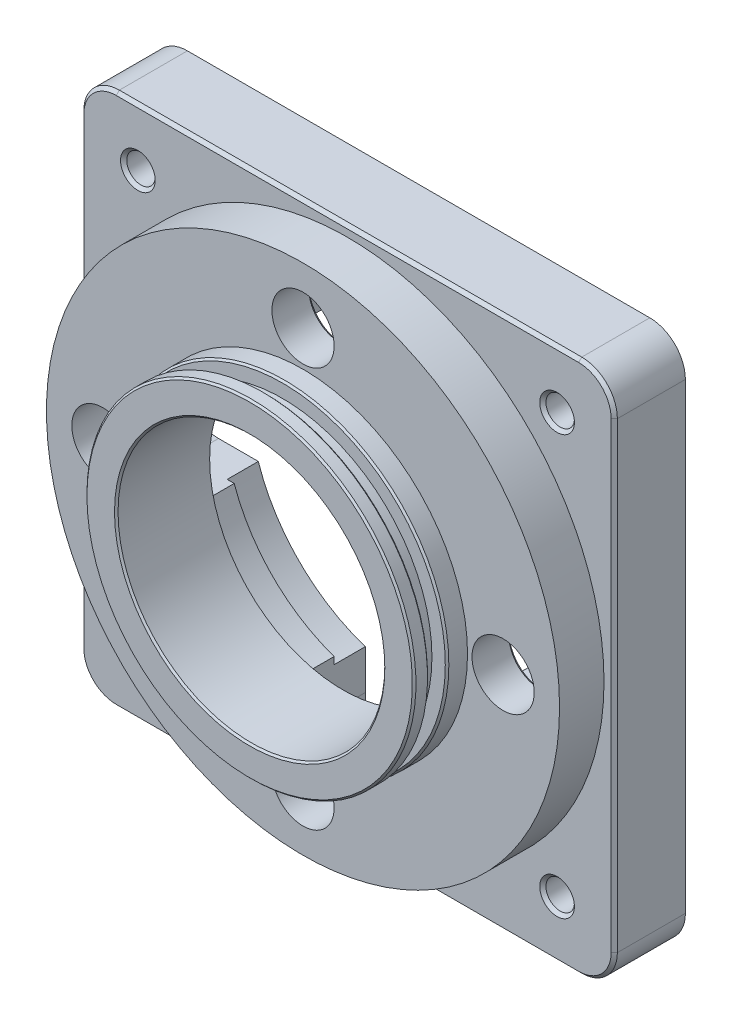
from build123d import *

# Parameters (mm, degrees)
SKICA1_W                    = 60
SKICA1_H                    = 60
P_IDAT_VYSUNUT_M1_DEPTH     = 10
SKICA2_R                    = 28.85
P_IDAT_VYSUNUT_M2_DEPTH     = 5
SKICA3_R                    = 18.5
P_IDAT_VYSUNUT_M3_DEPTH     = 6
SKICA4_R                    = 15
ODEBRAT_VYSUNUT_M1_DEPTH    = 48.339201514
SKICA5_W                    = 1.7
SKICA5_H                    = 2
ZKOSEN_1_SIZE               = 0.2
SKICA6_R                    = 1.6
ODEBRAT_VYSUNUT_M2_DEPTH    = 48.339201514
SKICA7_R                    = 3.5
ODEBRAT_VYSUNUT_M3_DEPTH    = 46
ODEBRAT_VYSUNUT_M6_DEPTH    = 10.5
SKICA9_R                    = 19
ODEBRAT_VYSUNUT_M7_DEPTH    = 5.5
ODEBRAT_VYSUNUT_M8_DEPTH    = 6
ZAOBLIT1_R                  = 4
ZKOSEN_2_SIZE               = 0.35
P_ESUNOUT_PLOCHU1_OUTLINE_R = 1.6
P_ESUNOUT_PLOCHU1_DEPTH     = 2


# Read off the part's stored shape, not the designer's step: Přesunout plochu1
with BuildPart() as part:
    # Skica1 → Přidat vysunutím1 (new body)
    with BuildSketch(Plane.XY):
        Rectangle(SKICA1_W, SKICA1_H)
    extrude(amount=P_IDAT_VYSUNUT_M1_DEPTH)

    # Skica2 → Přidat vysunutím2 (add)
    with BuildSketch(Plane.XY.offset(10)):
        Circle(SKICA2_R)
    extrude(amount=P_IDAT_VYSUNUT_M2_DEPTH)

    # Skica3 → Přidat vysunutím3 (add)
    with BuildSketch(Plane.XY.offset(15)):
        Circle(SKICA3_R)
    extrude(amount=P_IDAT_VYSUNUT_M3_DEPTH)

    # Skica4 → Odebrat vysunutím1 (cut, through all)
    with BuildSketch(Plane.XY.offset(21)):
        Circle(SKICA4_R)
    extrude(amount=-ODEBRAT_VYSUNUT_M1_DEPTH, mode=Mode.SUBTRACT)

    # Skica5 → Odebrat rotací1 (revolve, cut)
    with BuildSketch(Plane(origin=(0, 0, 0), x_dir=(1, 0, 0), z_dir=(0, 1, 0)), mode=Mode.PRIVATE) as odebrat_rotac_1_sk:
        with Locations((17.65, -18.3)):
            Rectangle(SKICA5_W, SKICA5_H)
    revolve(odebrat_rotac_1_sk.sketch.rotate(Axis((0, 0, 0), (0, 0, 1)), 180), axis=Axis((0, 0, 0), (0, 0, 1)), mode=Mode.SUBTRACT)

    # Zkosení1
    zkosen_1_edges = [part.edges().sort_by_distance(p)[0] for p in [
        (-18.5, 0, 21),
        (-15, 0, 21),
        (-18.5, 0, 19.3),
        (-18.5, 0, 17.3),
    ]]
    chamfer(zkosen_1_edges, length=ZKOSEN_1_SIZE)

    # Skica6 → Odebrat vysunutím2 (cut, through all)
    with BuildSketch(Plane(origin=(0, 0, 0), x_dir=(-1, 0, 0), z_dir=(0, 0, -1))):
        with Locations((-23.57, 23.57)):
            Circle(SKICA6_R)
        with Locations((23.57, 23.57)):
            Circle(SKICA6_R)
        with Locations(Location((23.57, -23.57, 0), (0, 0, 180))):
            Circle(SKICA6_R)
        with Locations(Location((-23.57, -23.57, 0), (0, 0, 180))):
            Circle(SKICA6_R)
    extrude(amount=-ODEBRAT_VYSUNUT_M2_DEPTH, mode=Mode.SUBTRACT)

    # Skica7 → Odebrat vysunutím3 (cut, through all)
    with BuildSketch(Plane.XY.offset(15)):
        with Locations((0, 22.5)):
            Circle(SKICA7_R)
        with Locations((0, -22.5)):
            Circle(SKICA7_R)
        with Locations((22.5, 0)):
            Circle(SKICA7_R)
        with Locations((-22.5, 0)):
            Circle(SKICA7_R)
    extrude(amount=-ODEBRAT_VYSUNUT_M3_DEPTH, mode=Mode.SUBTRACT)

    # Skica8 → Odebrat vysunutím6 (cut)
    with BuildSketch(Plane(origin=(0, 0, 0), x_dir=(-1, 0, 0), z_dir=(0, 0, -1))):
        with BuildLine():
            Line((-6, 22.5), (-6, 17.235501153))
            ThreePointArc((-6, 17.235501153), (-12.904698757, 12.904698757), (-17.235501153, 6))
            Line((-17.235501153, 6), (-22.5, 6))
            ThreePointArc((-22.5, 6), (-28.5, 0), (-22.5, -6))
            Line((-22.5, -6), (-17.235501153, -6))
            ThreePointArc((-17.235501153, -6), (-12.904698757, -12.904698757), (-6, -17.235501153))
            Line((-6, -17.235501153), (-6, -22.5))
            ThreePointArc((-6, -22.5), (0, -28.5), (6, -22.5))
            Line((6, -22.5), (6, -17.235501153))
            ThreePointArc((6, -17.235501153), (12.904698757, -12.904698757), (17.235501153, -6))
            Line((17.235501153, -6), (22.5, -6))
            ThreePointArc((22.5, -6), (28.5, 0), (22.5, 6))
            Line((22.5, 6), (17.235501153, 6))
            ThreePointArc((17.235501153, 6), (12.904698757, 12.904698757), (6, 17.235501153))
            Line((6, 17.235501153), (6, 22.5))
            ThreePointArc((6, 22.5), (0, 28.5), (-6, 22.5))
        make_face()
    extrude(amount=-ODEBRAT_VYSUNUT_M6_DEPTH, mode=Mode.SUBTRACT)

    # Skica9 → Odebrat vysunutím7 (cut)
    with BuildSketch(Plane(origin=(0, 0, 0), x_dir=(-1, 0, 0), z_dir=(0, 0, -1))):
        Circle(SKICA9_R)
    extrude(amount=-ODEBRAT_VYSUNUT_M7_DEPTH, mode=Mode.SUBTRACT)

    # Skica10 → Odebrat vysunutím8 (cut)
    with BuildSketch(Plane(origin=(0, 0, 0), x_dir=(-1, 0, 0), z_dir=(0, 0, -1))):
        with BuildLine():
            Line((26.9, 17.541642015), (26.9, 10.195587281))
            ThreePointArc((26.9, 10.195587281), (26.304000543, 8.998598133), (24.989622642, 8.752815496))
            ThreePointArc((24.989622642, 8.752815496), (23.75685699, 9.012785946), (22.5, 9.1))
            Line((22.5, 9.1), (20.774984958, 9.1))
            ThreePointArc((20.774984958, 9.1), (20.244527343, 9.25228854), (19.87563496, 9.662770563))
            ThreePointArc((19.87563496, 9.662770563), (15.627059864, 15.627059864), (9.662770563, 19.87563496))
            ThreePointArc((9.662770563, 19.87563496), (9.25228854, 20.244527343), (9.1, 20.774984958))
            Line((9.1, 20.774984958), (9.1, 22.5))
            ThreePointArc((9.1, 22.5), (9.012785946, 23.75685699), (8.752815496, 24.989622642))
            ThreePointArc((8.752815496, 24.989622642), (8.998598133, 26.304000543), (10.195587281, 26.9))
            Line((10.195587281, 26.9), (17.541642015, 26.9))
            ThreePointArc((17.541642015, 26.9), (18.746542722, 26.293428389), (18.976965344, 24.964285714))
            ThreePointArc((18.976965344, 24.964285714), (20.17588745, 20.17588745), (24.964285714, 18.976965344))
            ThreePointArc((24.964285714, 18.976965344), (26.293428389, 18.746542722), (26.9, 17.541642015))
        make_face()
        with BuildLine():
            Line((-20.774984958, 9.1), (-22.5, 9.1))
            ThreePointArc((-22.5, 9.1), (-23.75685699, 9.012785946), (-24.989622642, 8.752815496))
            ThreePointArc((-24.989622642, 8.752815496), (-26.304000543, 8.998598133), (-26.9, 10.195587281))
            Line((-26.9, 10.195587281), (-26.9, 17.541642015))
            ThreePointArc((-26.9, 17.541642015), (-26.293428389, 18.746542722), (-24.964285714, 18.976965344))
            ThreePointArc((-24.964285714, 18.976965344), (-20.17588745, 20.17588745), (-18.976965344, 24.964285714))
            ThreePointArc((-18.976965344, 24.964285714), (-18.746542722, 26.293428389), (-17.541642015, 26.9))
            Line((-17.541642015, 26.9), (-10.195587281, 26.9))
            ThreePointArc((-10.195587281, 26.9), (-8.998598133, 26.304000543), (-8.752815496, 24.989622642))
            ThreePointArc((-8.752815496, 24.989622642), (-9.012785946, 23.75685699), (-9.1, 22.5))
            Line((-9.1, 22.5), (-9.1, 20.774984958))
            ThreePointArc((-9.1, 20.774984958), (-9.25228854, 20.244527343), (-9.662770563, 19.87563496))
            ThreePointArc((-9.662770563, 19.87563496), (-15.627059864, 15.627059864), (-19.87563496, 9.662770563))
            ThreePointArc((-19.87563496, 9.662770563), (-20.244527343, 9.25228854), (-20.774984958, 9.1))
        make_face()
        with BuildLine():
            Line((-22.5, -9.1), (-20.774984958, -9.1))
            ThreePointArc((-20.774984958, -9.1), (-20.244527343, -9.25228854), (-19.87563496, -9.662770563))
            ThreePointArc((-19.87563496, -9.662770563), (-15.627059864, -15.627059864), (-9.662770563, -19.87563496))
            ThreePointArc((-9.662770563, -19.87563496), (-9.25228854, -20.244527343), (-9.1, -20.774984958))
            Line((-9.1, -20.774984958), (-9.1, -22.5))
            ThreePointArc((-9.1, -22.5), (-9.012785946, -23.75685699), (-8.752815496, -24.989622642))
            ThreePointArc((-8.752815496, -24.989622642), (-8.998598133, -26.304000543), (-10.195587281, -26.9))
            Line((-10.195587281, -26.9), (-17.541642015, -26.9))
            ThreePointArc((-17.541642015, -26.9), (-18.746542722, -26.293428389), (-18.976965344, -24.964285714))
            ThreePointArc((-18.976965344, -24.964285714), (-20.17588745, -20.17588745), (-24.964285714, -18.976965344))
            ThreePointArc((-24.964285714, -18.976965344), (-26.293428389, -18.746542722), (-26.9, -17.541642015))
            Line((-26.9, -17.541642015), (-26.9, -10.195587281))
            ThreePointArc((-26.9, -10.195587281), (-26.304000543, -8.998598133), (-24.989622642, -8.752815496))
            ThreePointArc((-24.989622642, -8.752815496), (-23.75685699, -9.012785946), (-22.5, -9.1))
        make_face()
        with BuildLine():
            Line((9.1, -22.5), (9.1, -20.774984958))
            ThreePointArc((9.1, -20.774984958), (9.25228854, -20.244527343), (9.662770563, -19.87563496))
            ThreePointArc((9.662770563, -19.87563496), (15.627059864, -15.627059864), (19.87563496, -9.662770563))
            ThreePointArc((19.87563496, -9.662770563), (20.244527343, -9.25228854), (20.774984958, -9.1))
            Line((20.774984958, -9.1), (22.5, -9.1))
            ThreePointArc((22.5, -9.1), (23.75685699, -9.012785946), (24.989622642, -8.752815496))
            ThreePointArc((24.989622642, -8.752815496), (26.304000543, -8.998598133), (26.9, -10.195587281))
            Line((26.9, -10.195587281), (26.9, -17.541642015))
            ThreePointArc((26.9, -17.541642015), (26.293428389, -18.746542722), (24.964285714, -18.976965344))
            ThreePointArc((24.964285714, -18.976965344), (20.17588745, -20.17588745), (18.976965344, -24.964285714))
            ThreePointArc((18.976965344, -24.964285714), (18.746542722, -26.293428389), (17.541642015, -26.9))
            Line((17.541642015, -26.9), (10.195587281, -26.9))
            ThreePointArc((10.195587281, -26.9), (8.998598133, -26.304000543), (8.752815496, -24.989622642))
            ThreePointArc((8.752815496, -24.989622642), (9.012785946, -23.75685699), (9.1, -22.5))
        make_face()
    extrude(amount=-ODEBRAT_VYSUNUT_M8_DEPTH, mode=Mode.SUBTRACT)

    # Zaoblit1
    zaoblit1_edges = [part.edges().sort_by_distance(p)[0] for p in [
        (30, -30, 5),
        (-30, -30, 5),
        (-30, 30, 5),
        (30, 30, 5),
    ]]
    fillet(zaoblit1_edges, radius=ZAOBLIT1_R)

    # Zkosení2
    zkosen_2_edges = [part.edges().sort_by_distance(p)[0] for p in [
        (-13.435028843, 13.435028843, 0),
        (-13.435028843, -13.435028843, 0),
        (13.435028843, -13.435028843, 0),
        (13.435028843, 13.435028843, 0),
        (30, 0, 10),
        (0, -30, 10),
        (0, 30, 10),
        (-30, 0, 10),
        (28.828427125, 28.828427125, 10),
        (-28.828427125, 28.828427125, 10),
        (-28.828427125, -28.828427125, 10),
        (28.828427125, -28.828427125, 10),
        (21.97, -23.57, 10),
        (21.97, -23.57, 0),
        (-25.17, -23.57, 10),
        (-25.17, -23.57, 0),
        (-21.97, 23.57, 10),
        (-21.97, 23.57, 0),
        (25.17, 23.57, 10),
        (25.17, 23.57, 0),
        (-26, 0, 10.5),
        (-3.5, -22.5, 10.5),
        (-3.5, 22.5, 10.5),
        (19, 0, 10.5),
    ]]
    chamfer(zkosen_2_edges, length=ZKOSEN_2_SIZE)

    # Přesunout plochu1 outline → Přesunout plochu1 (cut)
    with BuildSketch(Plane.XY):
        with BuildLine():
            Line((30, -26), (30, 26))
            ThreePointArc((30, 26), (28.828427125, 28.828427125), (26, 30))
            Line((26, 30), (-26, 30))
            ThreePointArc((-26, 30), (-28.828427125, 28.828427125), (-30, 26))
            Line((-30, 26), (-30, -26))
            ThreePointArc((-30, -26), (-28.828427125, -28.828427125), (-26, -30))
            Line((-26, -30), (26, -30))
            ThreePointArc((26, -30), (28.828427125, -28.828427125), (30, -26))
        make_face()
        with Locations((-23.57, -23.57)):
            Circle(P_ESUNOUT_PLOCHU1_OUTLINE_R, mode=Mode.SUBTRACT)
        with BuildLine():
            Line((-22.5, -9.1), (-20.774984958, -9.1))
            ThreePointArc((-20.774984958, -9.1), (-20.244527343, -9.25228854), (-19.87563496, -9.662770563))
            ThreePointArc((-19.87563496, -9.662770563), (-15.627059864, -15.627059864), (-9.662770563, -19.87563496))
            ThreePointArc((-9.662770563, -19.87563496), (-9.25228854, -20.244527343), (-9.1, -20.774984958))
            Line((-9.1, -20.774984958), (-9.1, -22.5))
            ThreePointArc((-9.1, -22.5), (-9.012785946, -23.756856991), (-8.752815496, -24.989622642))
            ThreePointArc((-8.752815496, -24.989622642), (-8.998598133, -26.304000543), (-10.195587281, -26.9))
            Line((-10.195587281, -26.9), (-17.541642015, -26.9))
            ThreePointArc((-17.541642015, -26.9), (-18.746542722, -26.293428389), (-18.976965344, -24.964285714))
            ThreePointArc((-18.976965344, -24.964285714), (-20.17588745, -20.17588745), (-24.964285714, -18.976965344))
            ThreePointArc((-24.964285714, -18.976965344), (-26.293428389, -18.746542722), (-26.9, -17.541642015))
            Line((-26.9, -17.541642015), (-26.9, -10.195587281))
            ThreePointArc((-26.9, -10.195587281), (-26.304000543, -8.998598133), (-24.989622642, -8.752815496))
            ThreePointArc((-24.989622642, -8.752815496), (-23.756856991, -9.012785946), (-22.5, -9.1))
        make_face(mode=Mode.SUBTRACT)
        with Locations((23.57, -23.57)):
            Circle(P_ESUNOUT_PLOCHU1_OUTLINE_R, mode=Mode.SUBTRACT)
        with BuildLine():
            Line((26.9, -10.195587281), (26.9, -17.541642015))
            ThreePointArc((26.9, -17.541642015), (26.293428389, -18.746542722), (24.964285714, -18.976965344))
            ThreePointArc((24.964285714, -18.976965344), (20.17588745, -20.17588745), (18.976965344, -24.964285714))
            ThreePointArc((18.976965344, -24.964285714), (18.746542722, -26.293428389), (17.541642015, -26.9))
            Line((17.541642015, -26.9), (10.195587281, -26.9))
            ThreePointArc((10.195587281, -26.9), (8.998598133, -26.304000543), (8.752815496, -24.989622642))
            ThreePointArc((8.752815496, -24.989622642), (9.012785946, -23.756856991), (9.1, -22.5))
            Line((9.1, -22.5), (9.1, -20.774984958))
            ThreePointArc((9.1, -20.774984958), (9.25228854, -20.244527343), (9.662770563, -19.87563496))
            ThreePointArc((9.662770563, -19.87563496), (15.627059864, -15.627059864), (19.87563496, -9.662770563))
            ThreePointArc((19.87563496, -9.662770563), (20.244527343, -9.25228854), (20.774984958, -9.1))
            Line((20.774984958, -9.1), (22.5, -9.1))
            ThreePointArc((22.5, -9.1), (23.756856991, -9.012785946), (24.989622642, -8.752815496))
            ThreePointArc((24.989622642, -8.752815496), (26.304000543, -8.998598133), (26.9, -10.195587281))
        make_face(mode=Mode.SUBTRACT)
        with BuildLine():
            ThreePointArc((-9.662770563, 19.87563496), (-15.627059864, 15.627059864), (-19.87563496, 9.662770563))
            ThreePointArc((-19.87563496, 9.662770563), (-20.244527343, 9.25228854), (-20.774984958, 9.1))
            Line((-20.774984958, 9.1), (-22.5, 9.1))
            ThreePointArc((-22.5, 9.1), (-23.756856991, 9.012785946), (-24.989622642, 8.752815496))
            ThreePointArc((-24.989622642, 8.752815496), (-26.304000543, 8.998598133), (-26.9, 10.195587281))
            Line((-26.9, 10.195587281), (-26.9, 17.541642015))
            ThreePointArc((-26.9, 17.541642015), (-26.293428389, 18.746542722), (-24.964285714, 18.976965344))
            ThreePointArc((-24.964285714, 18.976965344), (-20.17588745, 20.17588745), (-18.976965344, 24.964285714))
            ThreePointArc((-18.976965344, 24.964285714), (-18.746542722, 26.293428389), (-17.541642015, 26.9))
            Line((-17.541642015, 26.9), (-10.195587281, 26.9))
            ThreePointArc((-10.195587281, 26.9), (-8.998598133, 26.304000543), (-8.752815496, 24.989622642))
            ThreePointArc((-8.752815496, 24.989622642), (-9.012785946, 23.756856991), (-9.1, 22.5))
            Line((-9.1, 22.5), (-9.1, 20.774984958))
            ThreePointArc((-9.1, 20.774984958), (-9.25228854, 20.244527343), (-9.662770563, 19.87563496))
        make_face(mode=Mode.SUBTRACT)
        with Locations((-23.57, 23.57)):
            Circle(P_ESUNOUT_PLOCHU1_OUTLINE_R, mode=Mode.SUBTRACT)
        with BuildLine():
            Line((-6, 18.027756377), (-6, 22.5))
            ThreePointArc((-6, 22.5), (0, 28.5), (6, 22.5))
            Line((6, 22.5), (6, 18.027756377))
            ThreePointArc((6, 18.027756377), (13.435028843, 13.435028843), (18.027756377, 6))
            Line((18.027756377, 6), (22.5, 6))
            ThreePointArc((22.5, 6), (28.5, 0), (22.5, -6))
            Line((22.5, -6), (18.027756377, -6))
            ThreePointArc((18.027756377, -6), (13.435028843, -13.435028843), (6, -18.027756377))
            Line((6, -18.027756377), (6, -22.5))
            ThreePointArc((6, -22.5), (0, -28.5), (-6, -22.5))
            Line((-6, -22.5), (-6, -18.027756377))
            ThreePointArc((-6, -18.027756377), (-13.435028843, -13.435028843), (-18.027756377, -6))
            Line((-18.027756377, -6), (-22.5, -6))
            ThreePointArc((-22.5, -6), (-28.5, 0), (-22.5, 6))
            Line((-22.5, 6), (-18.027756377, 6))
            ThreePointArc((-18.027756377, 6), (-13.435028843, 13.435028843), (-6, 18.027756377))
        make_face(mode=Mode.SUBTRACT)
        with BuildLine():
            Line((26.9, 17.541642015), (26.9, 10.195587281))
            ThreePointArc((26.9, 10.195587281), (26.304000543, 8.998598133), (24.989622642, 8.752815496))
            ThreePointArc((24.989622642, 8.752815496), (23.756856991, 9.012785946), (22.5, 9.1))
            Line((22.5, 9.1), (20.774984958, 9.1))
            ThreePointArc((20.774984958, 9.1), (20.244527343, 9.25228854), (19.87563496, 9.662770563))
            ThreePointArc((19.87563496, 9.662770563), (15.627059864, 15.627059864), (9.662770563, 19.87563496))
            ThreePointArc((9.662770563, 19.87563496), (9.25228854, 20.244527343), (9.1, 20.774984958))
            Line((9.1, 20.774984958), (9.1, 22.5))
            ThreePointArc((9.1, 22.5), (9.012785946, 23.756856991), (8.752815496, 24.989622642))
            ThreePointArc((8.752815496, 24.989622642), (8.998598133, 26.304000543), (10.195587281, 26.9))
            Line((10.195587281, 26.9), (17.541642015, 26.9))
            ThreePointArc((17.541642015, 26.9), (18.746542722, 26.293428389), (18.976965344, 24.964285714))
            ThreePointArc((18.976965344, 24.964285714), (20.17588745, 20.17588745), (24.964285714, 18.976965344))
            ThreePointArc((24.964285714, 18.976965344), (26.293428389, 18.746542722), (26.9, 17.541642015))
        make_face(mode=Mode.SUBTRACT)
        with Locations((23.57, 23.57)):
            Circle(P_ESUNOUT_PLOCHU1_OUTLINE_R, mode=Mode.SUBTRACT)
    extrude(amount=P_ESUNOUT_PLOCHU1_DEPTH, mode=Mode.SUBTRACT)


solid = part.part
